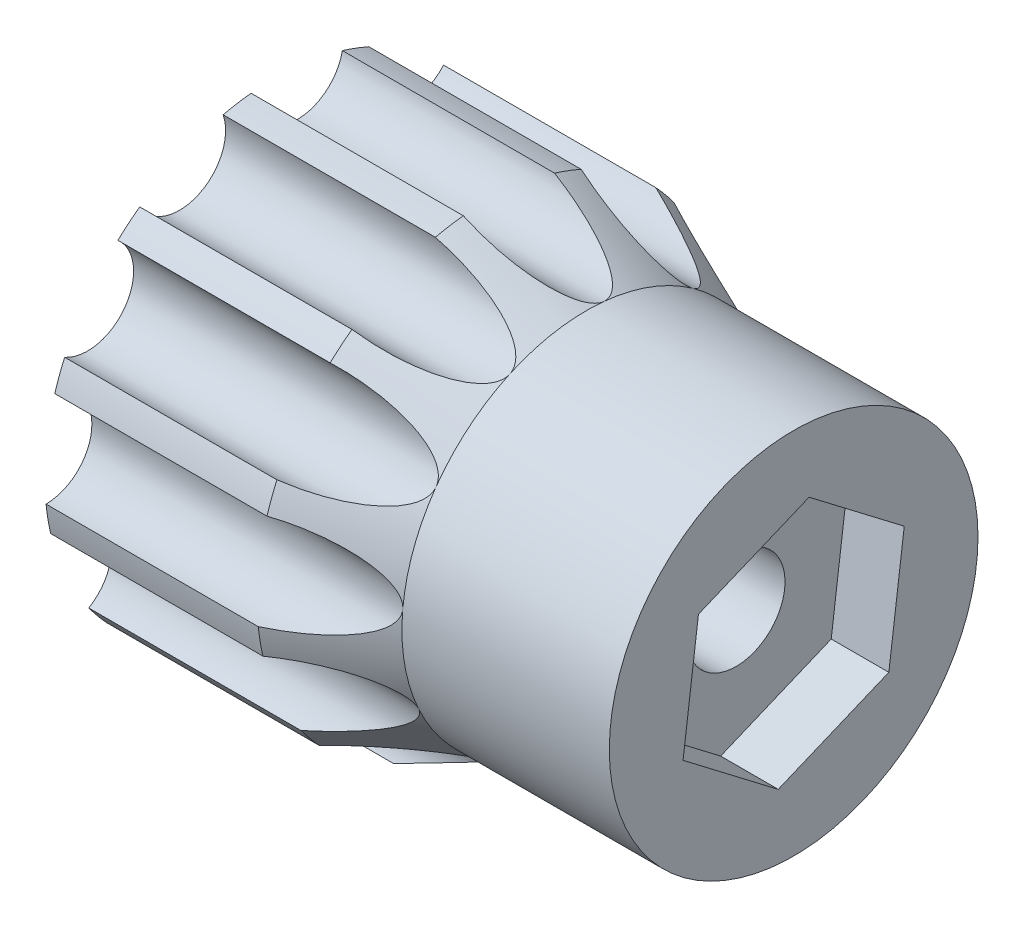
from build123d import *
from build123d.topology import SkipClean

# Parameters (mm, degrees)
SKETCH1_R           = 8
BOSS_EXTRUDE1_DEPTH = 25
CUT_EXTRUDE1_DEPTH  = 2.5
SKETCH3_R           = 10
BOSS_EXTRUDE2_DEPTH = 13.5
CHAMFER1_SIZE       = 2
CHAMFER1_SIZE_2     = 4.289013841
SKETCH4_R           = 2
CUT_EXTRUDE2_DEPTH  = 13.5
SKETCH5_R           = 2.125
CUT_EXTRUDE3_DEPTH  = 26.5
SKETCH6_R           = 5.3
CUT_EXTRUDE4_DEPTH  = 16.5
CUT_EXTRUDE5_DEPTH  = 2.5


with BuildPart() as part:
    # Sketch1 → Boss-Extrude1 (new body)
    with BuildSketch(Plane.ZY.offset(-195.554286556)):
        with Locations((-30.54542324, -8.572229683)):
            Circle(SKETCH1_R)
    extrude(amount=BOSS_EXTRUDE1_DEPTH)

    # Sketch2 → Cut-Extrude1 (cut)
    with BuildSketch(Plane(origin=(195.554286556, 0, 0), x_dir=(0, 0, -1), z_dir=(1, 0, 0))):
        Polygon((88.463786416, -29.984637668), (78.0482941, 30.880340181), (20.129930924, 52.292748166), (-27.372939935, 12.840178302), (-16.957447619, -48.024799546), (40.960915557, -69.437207531), align=None)
    extrude(amount=-CUT_EXTRUDE1_DEPTH, mode=Mode.SUBTRACT)

    # Sketch3 → Boss-Extrude2 (add)
    with BuildSketch(Plane.ZY.offset(-170.554286556)):
        with Locations((-30.54542324, -8.572229683)):
            Circle(SKETCH3_R)
    extrude(amount=-BOSS_EXTRUDE2_DEPTH)

    # Chamfer1
    # the kernel refuses this chamfer: 4.289013841, 2 mm, written as the material it takes off along each edge
    with BuildSketch(Plane(origin=(184.054286556, -8.572229683, -30.54542324), x_dir=(0, 0, 1), z_dir=(0, -1, 0))) as chamfer1_piece_1_section:
        Polygon((10 - CHAMFER1_SIZE, 0), (10, CHAMFER1_SIZE_2), (10, 0), align=None)
    chamfer1_piece_1 = revolve(axis=Axis((184.054286556, -8.572229683, -30.54542324), (-1, 0, 0)), mode=Mode.PRIVATE)
    chamfer1_piece_1 = chamfer1_piece_1 - Plane(origin=(181.860032497, -8.572229683, -30.54542324), x_dir=(0, 0, 1), z_dir=(1, 0, 0)) * Cylinder(8, 40, mode=Mode.PRIVATE)
    add(chamfer1_piece_1, mode=Mode.SUBTRACT)

    # Sketch4 → Cut-Extrude2 (cut)
    with SkipClean():  # the faces are left unmerged after this step: merging them gives an invalid solid
        with BuildSketch(Plane.ZY.offset(-170.554286556)):
            with Locations((-20.591012465, -7.618444527)):
                Circle(SKETCH4_R)
            with Locations((-21.447758052, -12.723432895)):
                Circle(SKETCH4_R)
            with Locations((-24.742215678, -16.716109716)):
                Circle(SKETCH4_R)
            with Locations((-29.591638085, -18.526640458)):
                Circle(SKETCH4_R)
            with Locations((-34.696626453, -17.669894872)):
                Circle(SKETCH4_R)
            with Locations((-38.689303273, -14.375437245)):
                Circle(SKETCH4_R)
            with Locations((-40.499834015, -9.526014839)):
                Circle(SKETCH4_R)
            with Locations((-39.643088429, -4.42102647)):
                Circle(SKETCH4_R)
            with Locations((-36.348630803, -0.42834965)):
                Circle(SKETCH4_R)
            with Locations((-31.499208396, 1.382181092)):
                Circle(SKETCH4_R)
            with Locations((-26.394220028, 0.525435506)):
                Circle(SKETCH4_R)
            with Locations((-22.401543208, -2.769022121)):
                Circle(SKETCH4_R)
        extrude(amount=-CUT_EXTRUDE2_DEPTH, mode=Mode.SUBTRACT)

    # Sketch5 → Cut-Extrude3 (cut)
    with SkipClean():  # the faces are left unmerged after this step: merging them gives an invalid solid
        with BuildSketch(Plane.ZY.offset(-170.554286556)):
            with Locations((-30.54542324, -8.572229683)):
                Circle(SKETCH5_R)
        extrude(amount=-CUT_EXTRUDE3_DEPTH, mode=Mode.SUBTRACT)

    # Sketch6 → Cut-Extrude4 (cut)
    with SkipClean():  # the faces are left unmerged after this step: merging them gives an invalid solid
        with BuildSketch(Plane.ZY.offset(-170.554286556)):
            with Locations((-30.54542324, -8.572229683)):
                Circle(SKETCH6_R)
        extrude(amount=-CUT_EXTRUDE4_DEPTH, mode=Mode.SUBTRACT)

    # Sketch7 → Cut-Extrude5 (cut)
    with SkipClean():  # the faces are left unmerged after this step: merging them gives an invalid solid
        with BuildSketch(Plane(origin=(193.054286556, 0, 0), x_dir=(0, 0, -1), z_dir=(1, 0, 0))):
            Polygon((35.344460413, -6.572785411), (31.213372294, -3.416419442), (26.414335121, -5.415863714), (25.746386068, -10.571673955), (29.877474187, -13.728039924), (34.67651136, -11.728595652), align=None)
        extrude(amount=-CUT_EXTRUDE5_DEPTH, mode=Mode.SUBTRACT)


solid = part.part
